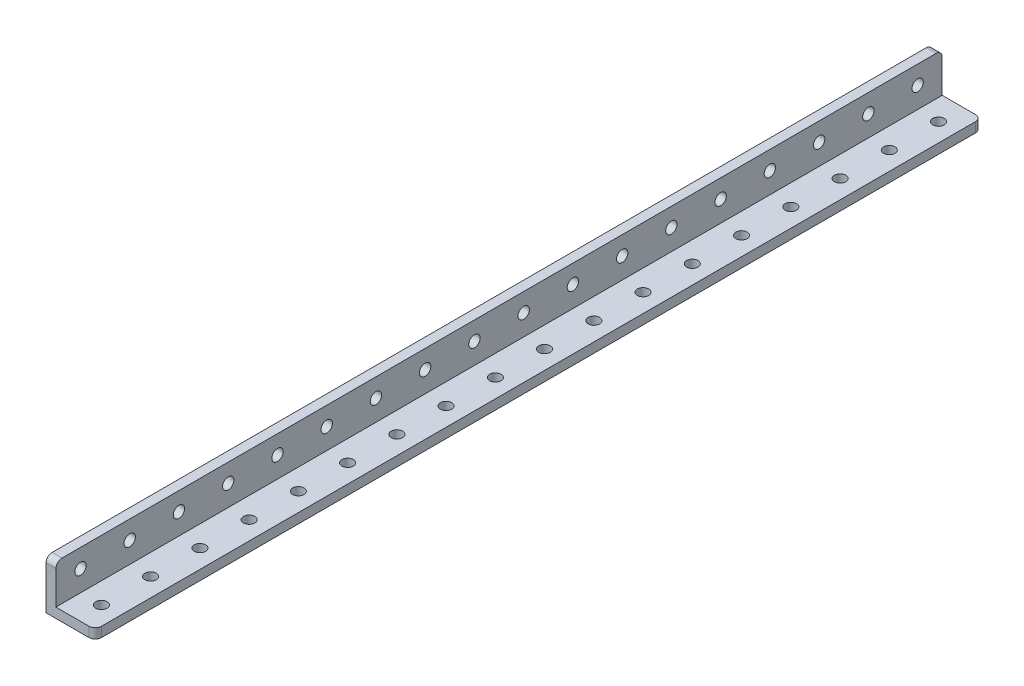
from build123d import *

# Parameters (mm, degrees)
BOSS_EXTRUDE1_DEPTH = 144
SKETCH2_R           = 1.85
CUT_EXTRUDE1_DEPTH  = 146.766937266
CUT_EXTRUDE2_REACH  = 147.45
SKETCH3_R           = 1.85
LPATTERN1_COUNT     = 18
LPATTERN1_PITCH     = 16
FILLET1_R           = 2


with BuildPart() as part:
    # Sketch1 → Boss-Extrude1 (new, symmetric)
    with BuildSketch(Plane.XY):
        Polygon((0, 0), (16, 0), (16, 3.2), (3.2, 3.2), (3.2, 16), (0, 16), align=None)
    extrude(amount=BOSS_EXTRUDE1_DEPTH, both=True)

    # Sketch2 → Cut-Extrude1 (cut, through all)
    with BuildSketch(Plane.ZY):
        with Locations((136, 10)):
            Circle(SKETCH2_R)
    cut_extrude1 = extrude(amount=-CUT_EXTRUDE1_DEPTH, mode=Mode.SUBTRACT)

    # Sketch3 → Cut-Extrude2 (cut, up to next)
    with BuildSketch(Plane(origin=(0, 3.2, 0), x_dir=(1, 0, 0), z_dir=(0, 1, 0)), mode=Mode.PRIVATE) as cut_extrude2_sk1:
        with Locations((10, -136)):
            Circle(SKETCH3_R)
    cut_extrude2_tool1 = extrude(cut_extrude2_sk1.sketch, amount=-CUT_EXTRUDE2_REACH, mode=Mode.PRIVATE) & part.part
    cut_extrude2 = cut_extrude2_tool1.solids().sort_by_distance((10, 3.2, 136))[0]
    add(cut_extrude2, mode=Mode.SUBTRACT)

    # LPattern1: Cut-Extrude1, Cut-Extrude2 ×18
    with Locations(*[(0, 0, -i * LPATTERN1_PITCH) for i in range(1, LPATTERN1_COUNT)]):
        add(cut_extrude1, mode=Mode.SUBTRACT)
        add(cut_extrude2, mode=Mode.SUBTRACT)

    # Fillet1
    fillet1_edges = [part.edges().sort_by_distance(p)[0] for p in [
        (1.6, 16, 144),
        (16, 1.6, 144),
        (16, 1.6, -144),
        (1.6, 16, -144),
    ]]
    fillet(fillet1_edges, radius=FILLET1_R)


solid = part.part
